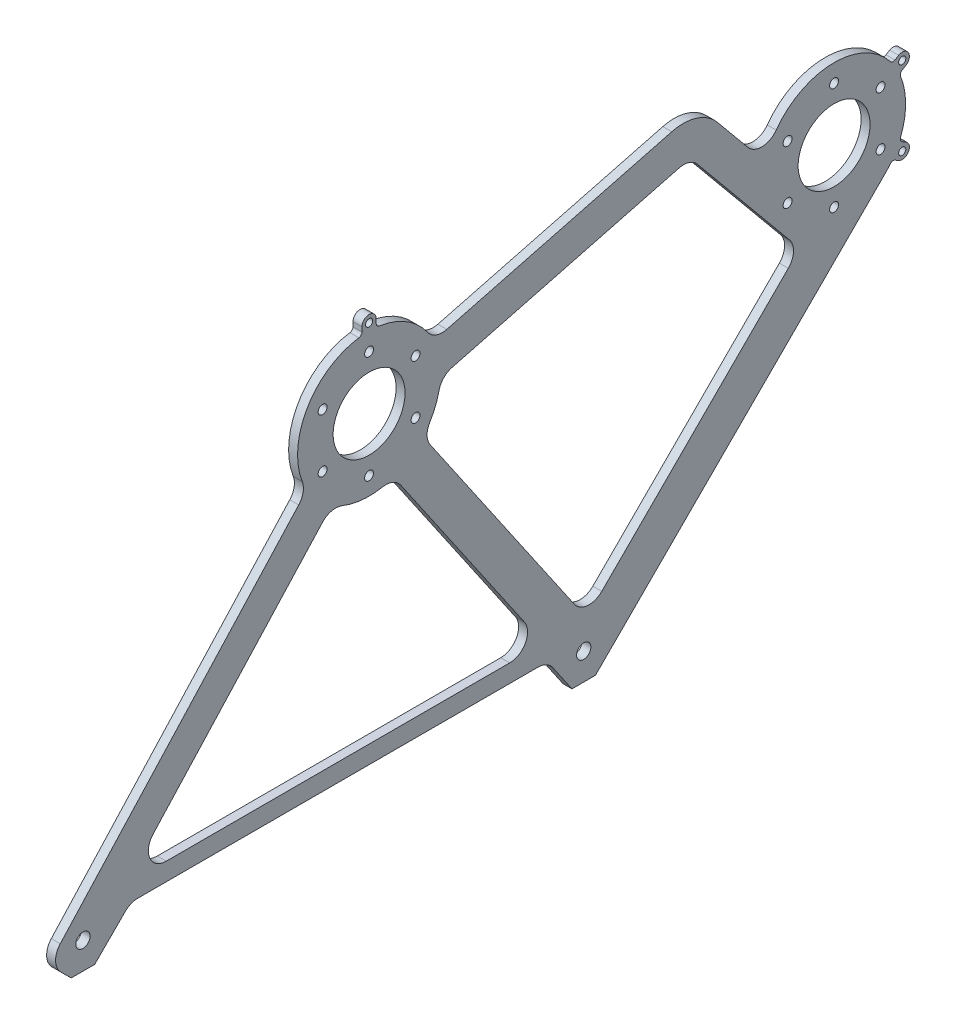
from build123d import *

# Parameters (mm, degrees)
SZKIC1_R                    = 2.5
SZKIC1_R_2                  = 4
SZKIC1_R_3                  = 2
SZKIC1_R_4                  = 20.1
DODANIE_WYCI_GNI_CIE1_DEPTH = 5


with BuildPart() as part:
    # Szkic1 → Dodanie-wyciągnięcie1 (new body)
    with BuildSketch(Plane(origin=(0, 0, 0), x_dir=(0, 0, -1), z_dir=(1, 0, 0))):
        with BuildLine():
            Line((236.87380623, 44.73996771), (75.158077478, -116.975761043))
            Line((75.158077478, -116.975761043), (62.020992488, -116.975761043))
            Line((62.020992488, -116.975761043), (51.285940907, -101.320477487))
            ThreePointArc((51.285940907, -101.320477487), (47.699508771, -98.128364941), (43.038652389, -96.975761043))
            Line((43.038652389, -96.975761043), (-180.699786898, -96.975761043))
            ThreePointArc((-180.699786898, -96.975761043), (-184.526621222, -97.736965717), (-187.77085471, -99.904693231))
            Line((-187.77085471, -99.904693231), (-204.841922522, -116.975761043))
            Line((-204.841922522, -116.975761043), (-217.979007512, -116.975761043))
            Line((-217.979007512, -116.975761043), (-223.798011589, -111.156756966))
            ThreePointArc((-223.798011589, -111.156756966), (-226.7244411, -104.309401647), (-224.107231897, -97.337997159))
            Line((-224.107231897, -97.337997159), (-90.765233328, 48.504813776))
            ThreePointArc((-90.765233328, 48.504813776), (-88.322913019, 53.377308809), (-88.798510162, 58.806852409))
            ThreePointArc((-88.798510162, 58.806852409), (-85.881529013, 93.315758047), (-57.124750731, 112.613971702))
            ThreePointArc((-57.124750731, 112.613971702), (-55.898607125, 113.284150998), (-55.410465017, 114.593458339))
            Line((-55.410465017, 114.593458339), (-55.410465017, 117.024238957))
            ThreePointArc((-55.410465017, 117.024238957), (-51.410465017, 121.024238957), (-47.410465017, 117.024238957))
            Line((-47.410465017, 117.024238957), (-47.410465017, 114.593458339))
            ThreePointArc((-47.410465017, 114.593458339), (-46.922322909, 113.284150998), (-45.696179303, 112.613971702))
            ThreePointArc((-45.696179303, 112.613971702), (-30.47744566, 107.109553986), (-18.685296412, 96.025615868))
            ThreePointArc((-18.685296412, 96.025615868), (-13.947421065, 92.387516097), (-7.980823285, 92.09951665))
            Line((-7.980823285, 92.09951665), (117.836034675, 124.906890993))
            ThreePointArc((117.836034675, 124.906890993), (131.838289199, 124.502285178), (143.424818017, 116.629599006))
            Line((143.424818017, 116.629599006), (160.419760745, 96.038899453))
            ThreePointArc((160.419760745, 96.038899453), (168.441673056, 92.409219241), (176.223581482, 96.528388675))
            ThreePointArc((176.223581482, 96.528388675), (207.812540786, 113.016691746), (240.018106411, 97.767821923))
            ThreePointArc((240.018106411, 97.767821923), (241.21157051, 97.041040059), (242.589534983, 97.272950263))
            Line((242.589534983, 97.272950263), (244.694652749, 98.488340573))
            ThreePointArc((244.694652749, 98.488340573), (250.158754365, 97.024238957), (248.694652749, 91.560137342))
            Line((248.694652749, 91.560137342), (246.589534983, 90.344747033))
            ThreePointArc((246.589534983, 90.344747033), (245.699712618, 89.267349896), (245.732392126, 87.870388737))
            ThreePointArc((245.732392126, 87.870388737), (248.589534983, 73.024238957), (245.732392126, 58.178089178))
            ThreePointArc((245.732392126, 58.178089178), (245.699712618, 56.781128019), (246.589534983, 55.703730882))
            Line((246.589534983, 55.703730882), (248.694652749, 54.488340573))
            ThreePointArc((248.694652749, 54.488340573), (250.158754365, 49.024238957), (244.694652749, 47.560137342))
            Line((244.694652749, 47.560137342), (242.589534983, 48.775527651))
            ThreePointArc((242.589534983, 48.775527651), (241.21157051, 49.007437856), (240.018106411, 48.280655992))
            ThreePointArc((240.018106411, 48.280655992), (238.498396771, 46.463742228), (236.87380623, 44.73996771))
        make_face()
        with Locations((234.570297096, 58.024238957)):
            Circle(SZKIC1_R, mode=Mode.SUBTRACT)
        with Locations((182.608772869, 58.024238957)):
            Circle(SZKIC1_R, mode=Mode.SUBTRACT)
        with Locations((208.589534983, 43.024238957)):
            Circle(SZKIC1_R, mode=Mode.SUBTRACT)
        with Locations((182.608772869, 88.024238957)):
            Circle(SZKIC1_R, mode=Mode.SUBTRACT)
        with Locations((208.589534983, 103.024238957)):
            Circle(SZKIC1_R, mode=Mode.SUBTRACT)
        with Locations((234.570297096, 88.024238957)):
            Circle(SZKIC1_R, mode=Mode.SUBTRACT)
        with Locations((-25.429702904, 58.024238957)):
            Circle(SZKIC1_R, mode=Mode.SUBTRACT)
        with Locations((-51.410465017, 103.024238957)):
            Circle(SZKIC1_R, mode=Mode.SUBTRACT)
        with Locations((-77.391227131, 58.024238957)):
            Circle(SZKIC1_R, mode=Mode.SUBTRACT)
        with Locations((-25.429702904, 88.024238957)):
            Circle(SZKIC1_R, mode=Mode.SUBTRACT)
        with Locations((-51.410465017, 43.024238957)):
            Circle(SZKIC1_R, mode=Mode.SUBTRACT)
        with Locations((-77.391227131, 88.024238957)):
            Circle(SZKIC1_R, mode=Mode.SUBTRACT)
        with Locations((-211.410465017, -101.975761043)):
            Circle(SZKIC1_R_2, mode=Mode.SUBTRACT)
        with Locations((68.589534983, -101.975761043)):
            Circle(SZKIC1_R_2, mode=Mode.SUBTRACT)
        with Locations((246.694652749, 95.024238957)):
            Circle(SZKIC1_R_3, mode=Mode.SUBTRACT)
        with Locations((246.694652749, 51.024238957)):
            Circle(SZKIC1_R_3, mode=Mode.SUBTRACT)
        with Locations((-51.410465017, 117.024238957)):
            Circle(SZKIC1_R_3, mode=Mode.SUBTRACT)
        with Locations((-51.410465017, 73.024238957)):
            Circle(SZKIC1_R_4, mode=Mode.SUBTRACT)
        with Locations((208.589534983, 73.024238957)):
            Circle(SZKIC1_R_4, mode=Mode.SUBTRACT)
        with BuildLine():
            Line((-164.841510757, -86.975761043), (27.196283356, -86.975761043))
            ThreePointArc((27.196283356, -86.975761043), (36.043679457, -81.636617426), (35.443571874, -71.320477487))
            Line((35.443571874, -71.320477487), (-33.741988566, 29.575131488))
            ThreePointArc((-33.741988566, 29.575131488), (-38.186626826, 33.168623582), (-43.873514671, 33.740726137))
            ThreePointArc((-43.873514671, 33.740726137), (-55.274906439, 33.211350435), (-66.361655452, 35.923539441))
            ThreePointArc((-66.361655452, 35.923539441), (-72.316202193, 36.39957081), (-77.479741181, 33.396056558))
            Line((-77.479741181, 33.396056558), (-172.221798877, -70.228069047))
            ThreePointArc((-172.221798877, -70.228069047), (-173.992382846, -81.008321026), (-164.841510757, -86.975761043))
        make_face(mode=Mode.SUBTRACT)
        with BuildLine():
            Line((182.985903971, 26.20740451), (78.685508463, -78.092990998))
            ThreePointArc((78.685508463, -78.092990998), (70.694122743, -80.979483879), (63.367152133, -76.677206741))
            Line((63.367152133, -76.677206741), (-17.247411529, 40.885698599))
            ThreePointArc((-17.247411529, 40.885698599), (-18.997826014, 46.326658425), (-17.482191412, 51.837633515))
            ThreePointArc((-17.482191412, 51.837633515), (-14.337746196, 58.00380224), (-12.303378029, 64.619731398))
            ThreePointArc((-12.303378029, 64.619731398), (-9.74938722, 69.434631946), (-5.049787258, 72.195047954))
            Line((-5.049787258, 72.195047954), (121.929365383, 105.305496443))
            ThreePointArc((121.929365383, 105.305496443), (127.530267192, 105.143654117), (132.16487872, 101.994579648))
            Line((132.16487872, 101.994579648), (183.62716852, 39.643998973))
            ThreePointArc((183.62716852, 39.643998973), (185.903467089, 32.801762622), (182.985903971, 26.20740451))
        make_face(mode=Mode.SUBTRACT)
    extrude(amount=DODANIE_WYCI_GNI_CIE1_DEPTH)


solid = part.part
